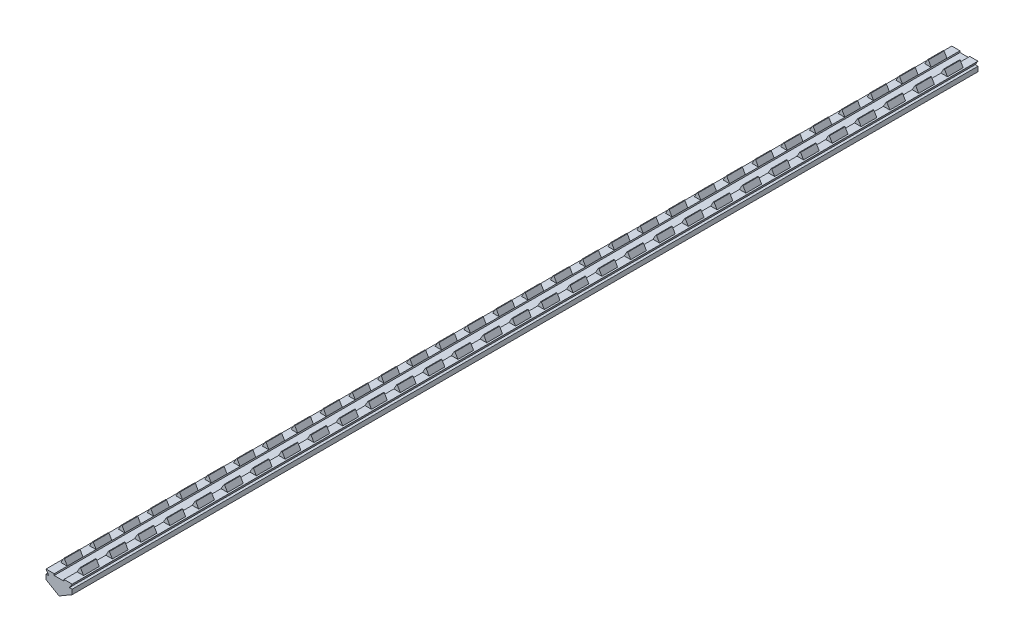
from build123d import *

# Parameters (mm, degrees)
BOSS_EXTRUDE1_DEPTH     = 207.5
CUT_EXTRUDE1_DEPTH      = 208.82745247
CUT_EXTRUDE1_DEPTH_BACK = 208.82745247
SKETCH2_W               = 6
SKETCH2_H               = 6


with BuildPart() as part:
    # Sketch1 → Boss-Extrude1 (new, symmetric)
    with BuildSketch(Plane.XY):
        Polygon((0, 0), (-6, 3.49909658), (-6, 5.69909658), (-4.75, 5.69909658), (-6, 7.69909658), (-5.2, 7.69909658), (-3.871572791, 10), (-3.541572791, 10), (-2.242534686, 7.75), (-2.242534686, 7), (2.242534686, 7), (2.242534686, 7.75), (3.541572791, 10), (3.871572791, 10), (5.2, 7.69909658), (6, 7.69909658), (4.75, 5.69909658), (6, 5.69909658), (6, 3.49909658), align=None)
    extrude(amount=BOSS_EXTRUDE1_DEPTH, both=True)

    # Sketch2 → Cut-Extrude1 (cut, two sides: drawn at the far end of the back side and taken through both)
    with BuildSketch(Plane(origin=(0, 0, 0), x_dir=(0, 0, -1), z_dir=(1, 0, 0)).offset(-CUT_EXTRUDE1_DEPTH_BACK)):
        with Locations((-191.30632723, 10.69909658)):
            Rectangle(SKETCH2_W, SKETCH2_H)
        with Locations((-204.5, 10.69909658)):
            Rectangle(SKETCH2_W, SKETCH2_H)
        with Locations((-178.112654461, 10.69909658)):
            Rectangle(SKETCH2_W, SKETCH2_H)
        with Locations((-164.918981691, 10.69909658)):
            Rectangle(SKETCH2_W, SKETCH2_H)
        with Locations((-151.725308922, 10.69909658)):
            Rectangle(SKETCH2_W, SKETCH2_H)
        with Locations((-138.531636152, 10.69909658)):
            Rectangle(SKETCH2_W, SKETCH2_H)
        with Locations((-125.337963383, 10.69909658)):
            Rectangle(SKETCH2_W, SKETCH2_H)
        with Locations((-112.144290613, 10.69909658)):
            Rectangle(SKETCH2_W, SKETCH2_H)
        with Locations((-98.950617843, 10.69909658)):
            Rectangle(SKETCH2_W, SKETCH2_H)
        with Locations((-85.756945074, 10.69909658)):
            Rectangle(SKETCH2_W, SKETCH2_H)
        with Locations((-72.563272304, 10.69909658)):
            Rectangle(SKETCH2_W, SKETCH2_H)
        with Locations((-59.369599535, 10.69909658)):
            Rectangle(SKETCH2_W, SKETCH2_H)
        with Locations((-46.175926765, 10.69909658)):
            Rectangle(SKETCH2_W, SKETCH2_H)
        with Locations((-32.982253996, 10.69909658)):
            Rectangle(SKETCH2_W, SKETCH2_H)
        with Locations((-19.788581226, 10.69909658)):
            Rectangle(SKETCH2_W, SKETCH2_H)
        with Locations((-6.594908456, 10.69909658)):
            Rectangle(SKETCH2_W, SKETCH2_H)
        with Locations((6.598764313, 10.69909658)):
            Rectangle(SKETCH2_W, SKETCH2_H)
        with Locations((19.792437083, 10.69909658)):
            Rectangle(SKETCH2_W, SKETCH2_H)
        with Locations((32.986109852, 10.69909658)):
            Rectangle(SKETCH2_W, SKETCH2_H)
        with Locations((46.179782622, 10.69909658)):
            Rectangle(SKETCH2_W, SKETCH2_H)
        with Locations((59.373455391, 10.69909658)):
            Rectangle(SKETCH2_W, SKETCH2_H)
        with Locations((72.567128161, 10.69909658)):
            Rectangle(SKETCH2_W, SKETCH2_H)
        with Locations((85.76080093, 10.69909658)):
            Rectangle(SKETCH2_W, SKETCH2_H)
        with Locations((98.9544737, 10.69909658)):
            Rectangle(SKETCH2_W, SKETCH2_H)
        with Locations((112.14814647, 10.69909658)):
            Rectangle(SKETCH2_W, SKETCH2_H)
        with Locations((125.341819239, 10.69909658)):
            Rectangle(SKETCH2_W, SKETCH2_H)
        with Locations((138.535492009, 10.69909658)):
            Rectangle(SKETCH2_W, SKETCH2_H)
        with Locations((151.729164778, 10.69909658)):
            Rectangle(SKETCH2_W, SKETCH2_H)
        with Locations((164.922837548, 10.69909658)):
            Rectangle(SKETCH2_W, SKETCH2_H)
        with Locations((178.116510317, 10.69909658)):
            Rectangle(SKETCH2_W, SKETCH2_H)
        with Locations((191.310183087, 10.69909658)):
            Rectangle(SKETCH2_W, SKETCH2_H)
        with Locations((204.503855857, 10.69909658)):
            Rectangle(SKETCH2_W, SKETCH2_H)
    extrude(amount=CUT_EXTRUDE1_DEPTH + CUT_EXTRUDE1_DEPTH_BACK, mode=Mode.SUBTRACT)


solid = part.part
